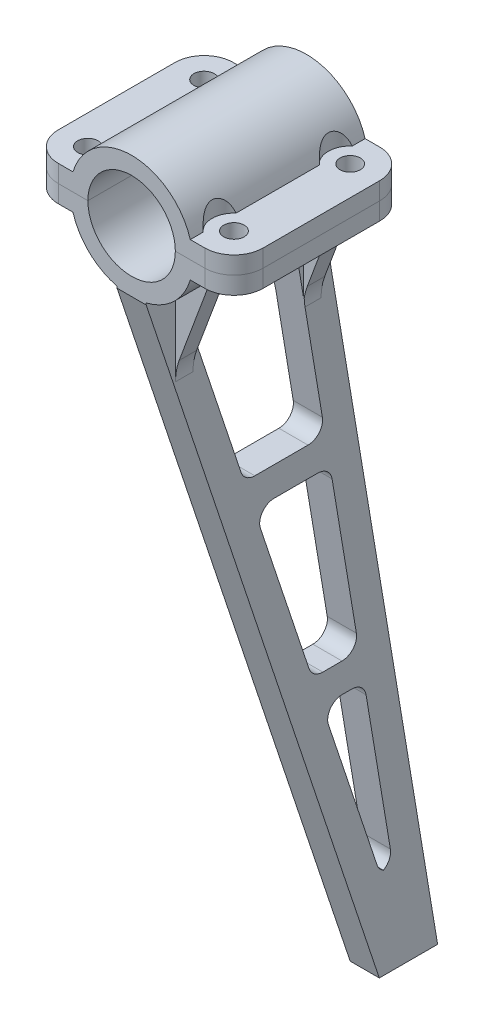
from build123d import *

# Parameters (mm, degrees)
LOWER_CLAMP_DEPTH                 = 30
UPPER_CLAMP_DEPTH                 = 30
SCREW_HOLES_DEPTH                 = 37.313696982
SCREW_HOLES_DEPTH_BACK            = 37.313696982
SKETCH5_R                         = 1.75
LOWER_CLAMP_FILLET_R              = 5
UPPER_CLAMP_FILLET_R              = 5
SKETCH3_W                         = 5
SKETCH3_H                         = 30
LOWER_CLAMP_BASE_DEPTH            = 3
LIGHTENING_HOLES_DEPTH            = 136.398471742
REMOVING_STRESS_CONCENTRATIONS_R  = 2.5
SKETCH9_R                         = 3.75
UPPER_CLAMP_SCREW_CLEARANCE_DEPTH = 138.951747438
SKETCH10_R                        = 3.75
LOWER_CLAMP_SCREW_CLEARANCE_DEPTH = 133.154018554
BOSS_EXTRUDE1_START               = -3
BOSS_EXTRUDE1_DEPTH               = 3
BOSS_EXTRUDE2_DEPTH               = 3
FILLET1_R                         = 10


with BuildPart() as part:
    # Sketch1 → Lower Clamp (new body)
    with BuildSketch(Plane.XY):
        with BuildLine():
            Line((-7.5, 0), (-17.562305899, 0))
            Line((-17.562305899, 0), (-17.562305899, -3))
            Line((-17.562305899, -3), (-10.062305899, -3))
            ThreePointArc((-10.062305899, -3), (0, -10.5), (10.062305899, -3))
            Line((10.062305899, -3), (17.562305899, -3))
            Line((17.562305899, -3), (17.562305899, 0))
            Line((17.562305899, 0), (7.5, 0))
            ThreePointArc((7.5, 0), (0, -7.5), (-7.5, 0))
        make_face()
    extrude(amount=LOWER_CLAMP_DEPTH)


with BuildPart() as body_2:
    # Sketch7 → Upper Clamp (new, through all)
    with BuildSketch(Plane.XY):
        with BuildLine():
            Line((-7.5, 0), (-17.562305899, 0))
            Line((-17.562305899, 0), (-17.562305899, 3))
            Line((-17.562305899, 3), (-10.062305899, 3))
            ThreePointArc((-10.062305899, 3), (0, 10.5), (10.062305899, 3))
            Line((10.062305899, 3), (17.562305899, 3))
            Line((17.562305899, 3), (17.562305899, 0))
            Line((17.562305899, 0), (7.5, 0))
            ThreePointArc((7.5, 0), (0, 7.5), (-7.5, 0))
        make_face()
    extrude(amount=UPPER_CLAMP_DEPTH)


with BuildPart() as screw_holes_tool:
    # Sketch5 → Screw Holes (new, two sides: drawn at the far end of the back side and taken through both)
    with BuildSketch(Plane(origin=(0, 0, 0), x_dir=(1, 0, 0), z_dir=(0, 1, 0)).offset(-SCREW_HOLES_DEPTH_BACK)):
        with Locations(Location((12.531152949, -5.031152949, 0), (0, 0, 180))):
            Circle(SKETCH5_R)
        with Locations(Location((12.531152949, -24.968847051, 0), (0, 0, 180))):
            Circle(SKETCH5_R)
        with Locations(Location((-12.531152949, -24.968847051, 0), (0, 0, 270))):
            Circle(SKETCH5_R)
        with Locations(Location((-12.531152949, -5.031152949, 0), (0, 0, 270))):
            Circle(SKETCH5_R)
    extrude(amount=SCREW_HOLES_DEPTH + SCREW_HOLES_DEPTH_BACK)


with BuildPart() as part_1:
    add(part.part)

    # Screw Holes: cut by screw_holes_tool
    add(screw_holes_tool.part, mode=Mode.SUBTRACT)

    # Lower Clamp Fillet
    lower_clamp_fillet_edges = [part_1.edges().sort_by_distance(p)[0] for p in [
        (-17.562305899, -1.5, 0),
        (-17.562305899, -1.5, 30),
        (17.562305899, -1.5, 30),
        (17.562305899, -1.5, 0),
    ]]
    fillet(lower_clamp_fillet_edges, radius=LOWER_CLAMP_FILLET_R)

    # Sketch3 → Lower Clamp Base (add)
    with BuildSketch(Plane(origin=(0, -10.5, 0), x_dir=(-1, 0, 0), z_dir=(0, -1, 0))):
        with Locations((0, -15)):
            Rectangle(SKETCH3_W, SKETCH3_H)
    extrude(amount=-LOWER_CLAMP_BASE_DEPTH)

    # Sketch4 → section 0 of leg
    with BuildSketch(Plane(origin=(0, -130.5, 0), x_dir=(-1, 0, 0), z_dir=(0, -1, 0)), mode=Mode.PRIVATE) as leg_s0:
        with BuildLine():
            Line((-2.5, 20), (2.5, 20))
            Line((2.5, 20), (2.5, 10))
            Line((2.5, 10), (-2.5, 10))
            Line((-2.5, 10), (-2.5, 20))
        make_face()
    # loft up to a face of the part (leg)
    loft([leg_s0.sketch, part_1.faces().sort_by_distance((0, -10.5, 15))[0]])

    # Sketch8 → Lightening Holes (cut, through all)
    with BuildSketch(Plane(origin=(2.5, 0, 0), x_dir=(0, 0, -1), z_dir=(1, 0, 0))):
        Polygon((-23.163524224, -15.198039027), (-4.285962271, -15.198039027), (0.714037729, -45.198039027), (-13.163524224, -45.198039027), align=None)
        Polygon((-11.496857557, -50.198039027), (1.547371063, -50.198039027), (6.547371063, -80.198039027), (-1.496857557, -80.198039027), align=None)
        Polygon((0.169809109, -85.198039027), (7.380704396, -85.198039027), (12.380704396, -115.198039027), (10.169809109, -115.198039027), align=None)
    extrude(amount=-LIGHTENING_HOLES_DEPTH, mode=Mode.SUBTRACT)

    # Removing Stress Concentrations
    # the kernel refuses this fillet: 2.5 mm, written as the material it adds along each edge
    with BuildSketch(Plane(origin=(2.5, -85.198039027, -0.169809109), x_dir=(0, -0.9486832980505134, -0.3162277660168391), z_dir=(-1, 0, 0)), Plane(origin=(2.5, -50.198039027, 11.496857557), x_dir=(0, -0.9486832980505135, -0.3162277660168387), z_dir=(-1, 0, 0)), Plane(origin=(2.5, -15.198039027, 23.163524224), x_dir=(0, -0.9486832980505134, -0.31622776601683916), z_dir=(-1, 0, 0))) as removing_stress_concentrations_piece_1:
        with BuildLine():
            CenterArc((REMOVING_STRESS_CONCENTRATIONS_R * 1.38742588672, -REMOVING_STRESS_CONCENTRATIONS_R), REMOVING_STRESS_CONCENTRATIONS_R, 90, 108.434948823)
            Line((REMOVING_STRESS_CONCENTRATIONS_R * 0.438742588672, -REMOVING_STRESS_CONCENTRATIONS_R * 1.31622776602), (0, 0))
            Line((0, 0), (REMOVING_STRESS_CONCENTRATIONS_R * 1.38742588672, 0))
        make_face()
    extrude(amount=5)
    with BuildSketch(Plane(origin=(2.5, -115.198039027, -10.169809109), x_dir=(0, 0.9486832980505143, 0.31622776601683644), z_dir=(-1, 0, 0)), Plane(origin=(2.5, -80.198039027, 1.496857557), x_dir=(0, 0.9486832980505141, 0.31622776601683705), z_dir=(-1, 0, 0)), Plane(origin=(2.5, -45.198039027, 13.163524224), x_dir=(0, 0.948683298050514, 0.31622776601683766), z_dir=(-1, 0, 0))) as removing_stress_concentrations_piece_2:
        with BuildLine():
            CenterArc((REMOVING_STRESS_CONCENTRATIONS_R * 0.720759220056, REMOVING_STRESS_CONCENTRATIONS_R), REMOVING_STRESS_CONCENTRATIONS_R, 198.434948823, 71.565051177)
            Line((-REMOVING_STRESS_CONCENTRATIONS_R * 0.227924077994, REMOVING_STRESS_CONCENTRATIONS_R * 0.683772233983), (0, 0))
            Line((0, 0), (REMOVING_STRESS_CONCENTRATIONS_R * 0.720759220056, 0))
        make_face()
    extrude(amount=5)
    with BuildSketch(Plane(origin=(2.5, -45.198039027, -0.714037729), x_dir=(0, 0, 1), z_dir=(-1, 0, 0)), Plane(origin=(2.5, -80.198039027, -6.547371063), x_dir=(0, 0, 1), z_dir=(-1, 0, 0)), Plane(origin=(2.5, -115.198039027, -12.380704396), x_dir=(0, 0, 1), z_dir=(-1, 0, 0))) as removing_stress_concentrations_piece_3:
        with BuildLine():
            CenterArc((REMOVING_STRESS_CONCENTRATIONS_R * 1.18046042172, REMOVING_STRESS_CONCENTRATIONS_R), REMOVING_STRESS_CONCENTRATIONS_R, 170.537677792, 99.462322208)
            Line((REMOVING_STRESS_CONCENTRATIONS_R * 0.194066497884, REMOVING_STRESS_CONCENTRATIONS_R * 1.16439898731), (0, 0))
            Line((0, 0), (REMOVING_STRESS_CONCENTRATIONS_R * 1.18046042172, 0))
        make_face()
    extrude(amount=5)
    with BuildSketch(Plane(origin=(2.5, -85.198039027, -7.380704396), x_dir=(0, -0.9863939238321436, -0.164398987305357), z_dir=(-1, 0, 0)), Plane(origin=(2.5, -50.198039027, -1.547371063), x_dir=(0, -0.9863939238321436, -0.16439898730535724), z_dir=(-1, 0, 0)), Plane(origin=(2.5, -15.198039027, 4.285962271), x_dir=(0, -0.9863939238321436, -0.16439898730535749), z_dir=(-1, 0, 0))) as removing_stress_concentrations_piece_4:
        with BuildLine():
            CenterArc((REMOVING_STRESS_CONCENTRATIONS_R * 0.847127088383, REMOVING_STRESS_CONCENTRATIONS_R), REMOVING_STRESS_CONCENTRATIONS_R, 189.462322208, 80.537677792)
            Line((-REMOVING_STRESS_CONCENTRATIONS_R * 0.139266835449, REMOVING_STRESS_CONCENTRATIONS_R * 0.835601012695), (0, 0))
            Line((0, 0), (REMOVING_STRESS_CONCENTRATIONS_R * 0.847127088383, 0))
        make_face()
    extrude(amount=5)

    # Sketch10 → Lower Clamp Screw Clearance (cut, through all)
    with BuildSketch(Plane.XZ.offset(3)):
        with Locations((12.531152949, 24.968847051)):
            Circle(SKETCH10_R)
        with Locations((12.531152949, 5.031152949)):
            Circle(SKETCH10_R)
        with Locations((-12.531152949, 5.031152949)):
            Circle(SKETCH10_R)
        with Locations((-12.531152949, 24.968847051)):
            Circle(SKETCH10_R)
    extrude(amount=LOWER_CLAMP_SCREW_CLEARANCE_DEPTH, mode=Mode.SUBTRACT)

    # Sketch11 → Boss-Extrude1 (add)
    with BuildSketch(Plane.XY.offset(24.976954477).offset(BOSS_EXTRUDE1_START)):
        with BuildLine():
            Line((-8.781161713, -5.756839321), (-2.5, -22.626050213))
            Line((-2.5, -22.626050213), (-2.5, -10.198039027))
            ThreePointArc((-2.5, -10.198039027), (-6.061948211, -8.573376458), (-8.781161713, -5.756839321))
        make_face()
        with BuildLine():
            Line((2.5, -22.626050213), (2.5, -10.198039027))
            ThreePointArc((2.5, -10.198039027), (6.061948211, -8.573376458), (8.781161713, -5.756839321))
            Line((8.781161713, -5.756839321), (2.5, -22.626050213))
        make_face()
    extrude(amount=BOSS_EXTRUDE1_DEPTH)

    # Sketch12 → Boss-Extrude2 (add)
    with BuildSketch(Plane(origin=(0, 0, 0), x_dir=(-1, 0, 0), z_dir=(0, 0, -1))):
        with BuildLine():
            Line((-8.781161713, -5.756839321), (-2.5, -22.626050213))
            Line((-2.5, -22.626050213), (-2.5, -18.757748269))
            Line((-2.5, -18.757748269), (-2.5, -16.677010644))
            Line((-2.5, -16.677010644), (-2.5, -10.198039027))
            ThreePointArc((-2.5, -10.198039027), (-6.061948211, -8.573376458), (-8.781161713, -5.756839321))
        make_face()
        with BuildLine():
            Line((2.5, -10.198039027), (2.5, -16.677010644))
            Line((2.5, -16.677010644), (2.5, -18.757748269))
            Line((2.5, -18.757748269), (2.5, -22.626050213))
            Line((2.5, -22.626050213), (8.781161713, -5.756839321))
            ThreePointArc((8.781161713, -5.756839321), (6.061948211, -8.573376458), (2.5, -10.198039027))
        make_face()
    extrude(amount=-BOSS_EXTRUDE2_DEPTH)

    # Fillet1
    # the kernel refuses this fillet: 10 mm, written as the material it adds along each edge
    with BuildSketch(Plane(origin=(-2.5, -22.626050213, 0), x_dir=(0, -1, 0), z_dir=(0, 0, 1))) as fillet1_piece_1_section:
        with BuildLine():
            CenterArc((FILLET1_R * 0.180131558089, -FILLET1_R), FILLET1_R, 90, 20.422549439)
            Line((-FILLET1_R * 0.168809340768, -FILLET1_R * 0.0628552677922), (0, 0))
            Line((0, 0), (FILLET1_R * 0.180131558089, 0))
        make_face()
    fillet1_piece_1 = extrude(amount=3, mode=Mode.PRIVATE)
    fillet1_piece_1 = split(fillet1_piece_1, bisect_by=Plane(origin=(-2.627061411, -22.895303424, 3.003084871), z_dir=(0, 0.16439898730535735, -0.9863939238321437)), keep=Keep.TOP, mode=Mode.PRIVATE)
    add(fillet1_piece_1)
    with BuildSketch(Plane(origin=(-8.781161713, -5.756839321, 0), x_dir=(-0.5213136693692532, 0.8533651376338063, 0), z_dir=(0, 0, 1))) as fillet1_piece_2:
        with BuildLine():
            CenterArc((0.988889209, 9.994910766), FILLET1_R, 259.00213828, 9.16983618)
            Line((-0.9188344, 0.178567728), (0, 0))
            ThreePointArc((0, 0), (0.334946345, 0.005343696), (0.66989269, 0))
        make_face()
    extrude(amount=3)
    with BuildSketch(Plane(origin=(-8.781161713, -5.756839321, 21.976954477), x_dir=(-0.5213136693692486, 0.8533651376338091, 0), z_dir=(0, 0, 1))) as fillet1_piece_3_section:
        with BuildLine():
            CenterArc((0.988889209, 9.994910766), FILLET1_R, 259.00213828, 9.16983618)
            Line((-0.9188344, 0.178567728), (0, 0))
            ThreePointArc((0, 0), (0.334946345, 0.005343696), (0.66989269, 0))
        make_face()
    fillet1_piece_3 = extrude(amount=5.323848116, mode=Mode.PRIVATE)
    fillet1_piece_3 = split(fillet1_piece_3, bisect_by=Plane(origin=(-8.766808087, -5.86439788, 24.976954477), z_dir=(0, 0, -1)), keep=Keep.TOP, mode=Mode.PRIVATE)
    fillet1_piece_3 = fillet1_piece_3 - Plane(origin=(-12.531152949, -5.86439788, 24.968847051), x_dir=(1, 0, 0), z_dir=(0, 1, 0)) * Cylinder(3.75, 15, mode=Mode.PRIVATE)
    add(fillet1_piece_3)
    with BuildSketch(Plane(origin=(-2.5, -22.626050213, 21.976954477), x_dir=(0, -1, 0), z_dir=(0, 0, 1))) as fillet1_piece_4:
        with BuildLine():
            CenterArc((FILLET1_R * 0.180131558089, -FILLET1_R), FILLET1_R, 90, 20.422549439)
            Line((-FILLET1_R * 0.168809340768, -FILLET1_R * 0.0628552677922), (0, 0))
            Line((0, 0), (FILLET1_R * 0.180131558089, 0))
        make_face()
    extrude(amount=3)
    with BuildSketch(Plane(origin=(2.5, -22.626050213, 21.976954477), x_dir=(0, -1, 0), z_dir=(0, 0, 1))) as fillet1_piece_5:
        with BuildLine():
            CenterArc((FILLET1_R * 0.180131558089, FILLET1_R), FILLET1_R, 249.577450561, 20.422549439)
            Line((-FILLET1_R * 0.168809340768, FILLET1_R * 0.0628552677922), (0, 0))
            Line((0, 0), (FILLET1_R * 0.180131558089, 0))
        make_face()
    extrude(amount=3)
    with BuildSketch(Plane(origin=(2.5, -22.626050213, 0), x_dir=(0, -1, 0), z_dir=(0, 0, 1))) as fillet1_piece_6_section:
        with BuildLine():
            CenterArc((FILLET1_R * 0.180131558089, FILLET1_R), FILLET1_R, 249.577450561, 20.422549439)
            Line((-FILLET1_R * 0.168809340768, FILLET1_R * 0.0628552677922), (0, 0))
            Line((0, 0), (FILLET1_R * 0.180131558089, 0))
        make_face()
    fillet1_piece_6 = extrude(amount=3, mode=Mode.PRIVATE)
    fillet1_piece_6 = split(fillet1_piece_6, bisect_by=Plane(origin=(2.627061411, -22.895303424, 3.003084871), z_dir=(0, 0.16439898730535735, -0.9863939238321437)), keep=Keep.TOP, mode=Mode.PRIVATE)
    add(fillet1_piece_6)
    with BuildSketch(Plane(origin=(8.781161713, -5.756839321, 0), x_dir=(0.5213136693692498, 0.8533651376338082, 0), z_dir=(0, 0, 1))) as fillet1_piece_7:
        with BuildLine():
            CenterArc((0.988889209, -9.994910766), FILLET1_R, 91.828025541, 9.16983618)
            Line((-0.9188344, -0.178567728), (0, 0))
            ThreePointArc((0, 0), (0.334946345, -0.005343696), (0.66989269, 0))
        make_face()
    extrude(amount=3)
    with BuildSketch(Plane(origin=(8.781161713, -5.756839321, 21.976954477), x_dir=(0.5213136693692572, 0.8533651376338038, 0), z_dir=(0, 0, 1))) as fillet1_piece_8_section:
        with BuildLine():
            CenterArc((0.988889209, -9.994910766), FILLET1_R, 91.828025541, 9.16983618)
            Line((-0.9188344, -0.178567728), (0, 0))
            ThreePointArc((0, 0), (0.334946345, -0.005343696), (0.66989269, 0))
        make_face()
    fillet1_piece_8 = extrude(amount=5.323848143, mode=Mode.PRIVATE)
    fillet1_piece_8 = split(fillet1_piece_8, bisect_by=Plane(origin=(8.766808144, -5.864397751, 24.976954477), z_dir=(0, 0, -1)), keep=Keep.TOP, mode=Mode.PRIVATE)
    fillet1_piece_8 = fillet1_piece_8 - Plane(origin=(12.531152949, -5.864397751, 24.968847051), x_dir=(1, 0, 0), z_dir=(0, 1, 0)) * Cylinder(3.75, 15, mode=Mode.PRIVATE)
    add(fillet1_piece_8)


with BuildPart() as body_2_1:
    add(body_2.part)

    # Screw Holes: cut by screw_holes_tool
    add(screw_holes_tool.part, mode=Mode.SUBTRACT)

    # Upper Clamp Fillet
    upper_clamp_fillet_edges = [body_2_1.edges().sort_by_distance(p)[0] for p in [
        (-17.562305899, 1.5, 0),
        (-17.562305899, 1.5, 30),
        (17.562305899, 1.5, 30),
        (17.562305899, 1.5, 0),
    ]]
    fillet(upper_clamp_fillet_edges, radius=UPPER_CLAMP_FILLET_R)

    # Sketch9 → Upper Clamp Screw Clearance (cut, through all)
    with BuildSketch(Plane(origin=(0, 3, 0), x_dir=(1, 0, 0), z_dir=(0, 1, 0))):
        with Locations((12.531152949, -5.031152949)):
            Circle(SKETCH9_R)
        with Locations((12.531152949, -24.968847051)):
            Circle(SKETCH9_R)
        with Locations((-12.531152949, -24.968847051)):
            Circle(SKETCH9_R)
        with Locations((-12.531152949, -5.031152949)):
            Circle(SKETCH9_R)
    extrude(amount=UPPER_CLAMP_SCREW_CLEARANCE_DEPTH, mode=Mode.SUBTRACT)


solid = Compound([part_1.part, body_2_1.part])
